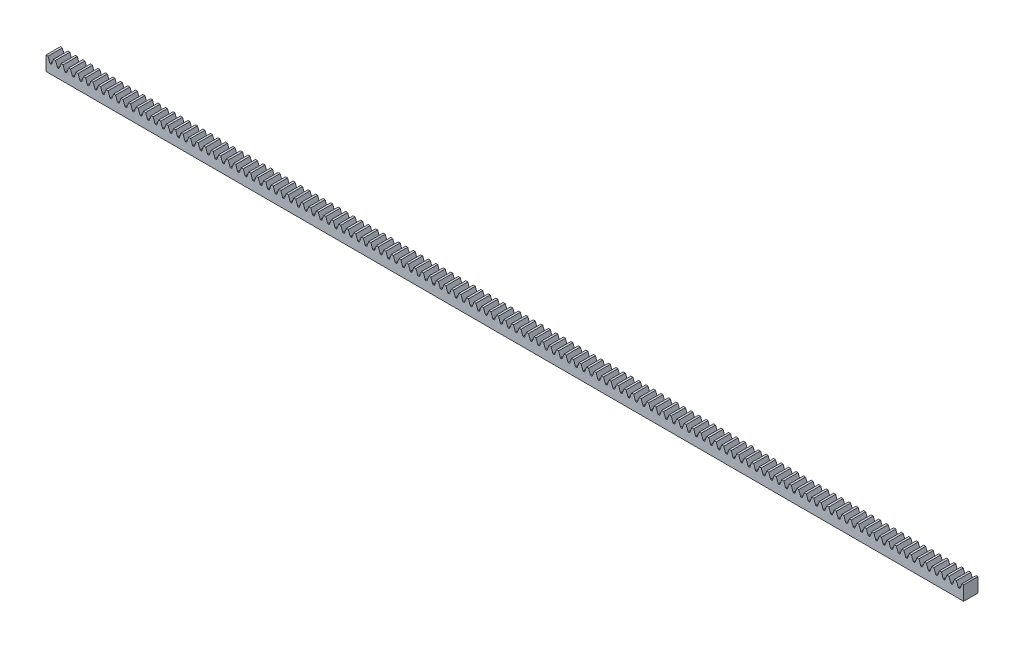
from build123d import *

# Parameters (mm, degrees)
BOSS_EXTRUDE1_DEPTH      = 152.4
BOSS_EXTRUDE1_DEPTH_BACK = 152.4
SKETCH2_W                = 4.7625
SKETCH2_H                = 4.7625
CUT_EXTRUDE1_DEPTH       = 153.492989209
FILLET1_R                = 0.154943948
LPATTERN1_START          = -2.38125
LPATTERN1_DEPTH          = 4.7625


# Read off the part's stored shape, not the designer's step: LPattern1
with BuildPart() as part:
    # Sketch2 → Boss-Extrude1 (new, two sides: drawn at the far end of the back side and taken through both)
    with BuildSketch(Plane(origin=(0, 0, 0), x_dir=(0, 0, -1), z_dir=(1, 0, 0)).offset(-BOSS_EXTRUDE1_DEPTH_BACK)):
        with Locations((0, 2.38125)):
            Rectangle(SKETCH2_W, SKETCH2_H)
    extrude(amount=BOSS_EXTRUDE1_DEPTH + BOSS_EXTRUDE1_DEPTH_BACK)

    # Sketch3 → Cut-Extrude1 (cut, symmetric)
    with BuildSketch(Plane.XY):
        Polygon((-151.730980247, 4.7625), (-151.076907537, 2.96545), (-150.560427709, 2.96545), (-149.906355, 4.7625), align=None)
    extrude(amount=CUT_EXTRUDE1_DEPTH, both=True, mode=Mode.SUBTRACT)

    # Fillet1
    fillet1_edges = [part.edges().sort_by_distance(p)[0] for p in [
        (-150.560427709, 2.96545, 0),
        (-151.076907537, 2.96545, 0),
    ]]
    fillet(fillet1_edges, radius=FILLET1_R)

    # LPattern1 outline → LPattern1 (cut)
    with BuildSketch(Plane.XY.offset(LPATTERN1_START)):
        with BuildLine():
            ThreePointArc((-148.620369302, 3.067399997), (-148.563641815, 2.993471296), (-148.474769617, 2.96545))
            Line((-148.474769617, 2.96545), (-148.17527563, 2.96545))
            ThreePointArc((-148.17527563, 2.96545), (-148.086403432, 2.993471296), (-148.029675945, 3.067399997))
            Line((-148.029675945, 3.067399997), (-147.41271, 4.7625))
            Line((-147.41271, 4.7625), (-149.237335247, 4.7625))
            Line((-149.237335247, 4.7625), (-148.620369302, 3.067399997))
        make_face()
        with BuildLine():
            Line((151.82469, 4.7625), (150.000064753, 4.7625))
            Line((150.000064753, 4.7625), (150.617030698, 3.067399997))
            ThreePointArc((150.617030698, 3.067399997), (150.673758185, 2.993471296), (150.762630383, 2.96545))
            Line((150.762630383, 2.96545), (151.06212437, 2.96545))
            ThreePointArc((151.06212437, 2.96545), (151.150996568, 2.993471296), (151.207724055, 3.067399997))
            Line((151.207724055, 3.067399997), (151.82469, 4.7625))
        make_face()
        with BuildLine():
            Line((149.331045, 4.7625), (147.506419753, 4.7625))
            Line((147.506419753, 4.7625), (148.123385698, 3.067399997))
            ThreePointArc((148.123385698, 3.067399997), (148.180113185, 2.993471296), (148.268985383, 2.96545))
            Line((148.268985383, 2.96545), (148.56847937, 2.96545))
            ThreePointArc((148.56847937, 2.96545), (148.657351568, 2.993471296), (148.714079055, 3.067399997))
            Line((148.714079055, 3.067399997), (149.331045, 4.7625))
        make_face()
        with BuildLine():
            Line((146.8374, 4.7625), (145.012774753, 4.7625))
            Line((145.012774753, 4.7625), (145.629740698, 3.067399997))
            ThreePointArc((145.629740698, 3.067399997), (145.686468185, 2.993471296), (145.775340383, 2.96545))
            Line((145.775340383, 2.96545), (146.07483437, 2.96545))
            ThreePointArc((146.07483437, 2.96545), (146.163706568, 2.993471296), (146.220434055, 3.067399997))
            Line((146.220434055, 3.067399997), (146.8374, 4.7625))
        make_face()
        with BuildLine():
            Line((144.343755, 4.7625), (142.519129753, 4.7625))
            Line((142.519129753, 4.7625), (143.136095698, 3.067399997))
            ThreePointArc((143.136095698, 3.067399997), (143.192823185, 2.993471296), (143.281695383, 2.96545))
            Line((143.281695383, 2.96545), (143.58118937, 2.96545))
            ThreePointArc((143.58118937, 2.96545), (143.670061568, 2.993471296), (143.726789055, 3.067399997))
            Line((143.726789055, 3.067399997), (144.343755, 4.7625))
        make_face()
        with BuildLine():
            Line((141.85011, 4.7625), (140.025484753, 4.7625))
            Line((140.025484753, 4.7625), (140.642450698, 3.067399997))
            ThreePointArc((140.642450698, 3.067399997), (140.699178185, 2.993471296), (140.788050383, 2.96545))
            Line((140.788050383, 2.96545), (141.08754437, 2.96545))
            ThreePointArc((141.08754437, 2.96545), (141.176416568, 2.993471296), (141.233144055, 3.067399997))
            Line((141.233144055, 3.067399997), (141.85011, 4.7625))
        make_face()
        with BuildLine():
            Line((139.356465, 4.7625), (137.531839753, 4.7625))
            Line((137.531839753, 4.7625), (138.148805698, 3.067399997))
            ThreePointArc((138.148805698, 3.067399997), (138.205533185, 2.993471296), (138.294405383, 2.96545))
            Line((138.294405383, 2.96545), (138.59389937, 2.96545))
            ThreePointArc((138.59389937, 2.96545), (138.682771568, 2.993471296), (138.739499055, 3.067399997))
            Line((138.739499055, 3.067399997), (139.356465, 4.7625))
        make_face()
        with BuildLine():
            Line((136.86282, 4.7625), (135.038194753, 4.7625))
            Line((135.038194753, 4.7625), (135.655160698, 3.067399997))
            ThreePointArc((135.655160698, 3.067399997), (135.711888185, 2.993471296), (135.800760383, 2.96545))
            Line((135.800760383, 2.96545), (136.10025437, 2.96545))
            ThreePointArc((136.10025437, 2.96545), (136.189126568, 2.993471296), (136.245854055, 3.067399997))
            Line((136.245854055, 3.067399997), (136.86282, 4.7625))
        make_face()
        with BuildLine():
            Line((134.369175, 4.7625), (132.544549753, 4.7625))
            Line((132.544549753, 4.7625), (133.161515698, 3.067399997))
            ThreePointArc((133.161515698, 3.067399997), (133.218243185, 2.993471296), (133.307115383, 2.96545))
            Line((133.307115383, 2.96545), (133.60660937, 2.96545))
            ThreePointArc((133.60660937, 2.96545), (133.695481568, 2.993471296), (133.752209055, 3.067399997))
            Line((133.752209055, 3.067399997), (134.369175, 4.7625))
        make_face()
        with BuildLine():
            Line((131.87553, 4.7625), (130.050904753, 4.7625))
            Line((130.050904753, 4.7625), (130.667870698, 3.067399997))
            ThreePointArc((130.667870698, 3.067399997), (130.724598185, 2.993471296), (130.813470383, 2.96545))
            Line((130.813470383, 2.96545), (131.11296437, 2.96545))
            ThreePointArc((131.11296437, 2.96545), (131.201836568, 2.993471296), (131.258564055, 3.067399997))
            Line((131.258564055, 3.067399997), (131.87553, 4.7625))
        make_face()
        with BuildLine():
            Line((129.381885, 4.7625), (127.557259753, 4.7625))
            Line((127.557259753, 4.7625), (128.174225698, 3.067399997))
            ThreePointArc((128.174225698, 3.067399997), (128.230953185, 2.993471296), (128.319825383, 2.96545))
            Line((128.319825383, 2.96545), (128.61931937, 2.96545))
            ThreePointArc((128.61931937, 2.96545), (128.708191568, 2.993471296), (128.764919055, 3.067399997))
            Line((128.764919055, 3.067399997), (129.381885, 4.7625))
        make_face()
        with BuildLine():
            Line((126.88824, 4.7625), (125.063614753, 4.7625))
            Line((125.063614753, 4.7625), (125.680580698, 3.067399997))
            ThreePointArc((125.680580698, 3.067399997), (125.737308185, 2.993471296), (125.826180383, 2.96545))
            Line((125.826180383, 2.96545), (126.12567437, 2.96545))
            ThreePointArc((126.12567437, 2.96545), (126.214546568, 2.993471296), (126.271274055, 3.067399997))
            Line((126.271274055, 3.067399997), (126.88824, 4.7625))
        make_face()
        with BuildLine():
            Line((124.394595, 4.7625), (122.569969753, 4.7625))
            Line((122.569969753, 4.7625), (123.186935698, 3.067399997))
            ThreePointArc((123.186935698, 3.067399997), (123.243663185, 2.993471296), (123.332535383, 2.96545))
            Line((123.332535383, 2.96545), (123.63202937, 2.96545))
            ThreePointArc((123.63202937, 2.96545), (123.720901568, 2.993471296), (123.777629055, 3.067399997))
            Line((123.777629055, 3.067399997), (124.394595, 4.7625))
        make_face()
        with BuildLine():
            Line((121.90095, 4.7625), (120.076324753, 4.7625))
            Line((120.076324753, 4.7625), (120.693290698, 3.067399997))
            ThreePointArc((120.693290698, 3.067399997), (120.750018185, 2.993471296), (120.838890383, 2.96545))
            Line((120.838890383, 2.96545), (121.13838437, 2.96545))
            ThreePointArc((121.13838437, 2.96545), (121.227256568, 2.993471296), (121.283984055, 3.067399997))
            Line((121.283984055, 3.067399997), (121.90095, 4.7625))
        make_face()
        with BuildLine():
            Line((119.407305, 4.7625), (117.582679753, 4.7625))
            Line((117.582679753, 4.7625), (118.199645698, 3.067399997))
            ThreePointArc((118.199645698, 3.067399997), (118.256373185, 2.993471296), (118.345245383, 2.96545))
            Line((118.345245383, 2.96545), (118.64473937, 2.96545))
            ThreePointArc((118.64473937, 2.96545), (118.733611568, 2.993471296), (118.790339055, 3.067399997))
            Line((118.790339055, 3.067399997), (119.407305, 4.7625))
        make_face()
        with BuildLine():
            Line((116.91366, 4.7625), (115.089034753, 4.7625))
            Line((115.089034753, 4.7625), (115.706000698, 3.067399997))
            ThreePointArc((115.706000698, 3.067399997), (115.762728185, 2.993471296), (115.851600383, 2.96545))
            Line((115.851600383, 2.96545), (116.15109437, 2.96545))
            ThreePointArc((116.15109437, 2.96545), (116.239966568, 2.993471296), (116.296694055, 3.067399997))
            Line((116.296694055, 3.067399997), (116.91366, 4.7625))
        make_face()
        with BuildLine():
            Line((114.420015, 4.7625), (112.595389753, 4.7625))
            Line((112.595389753, 4.7625), (113.212355698, 3.067399997))
            ThreePointArc((113.212355698, 3.067399997), (113.269083185, 2.993471296), (113.357955383, 2.96545))
            Line((113.357955383, 2.96545), (113.65744937, 2.96545))
            ThreePointArc((113.65744937, 2.96545), (113.746321568, 2.993471296), (113.803049055, 3.067399997))
            Line((113.803049055, 3.067399997), (114.420015, 4.7625))
        make_face()
        with BuildLine():
            Line((111.92637, 4.7625), (110.101744753, 4.7625))
            Line((110.101744753, 4.7625), (110.718710698, 3.067399997))
            ThreePointArc((110.718710698, 3.067399997), (110.775438185, 2.993471296), (110.864310383, 2.96545))
            Line((110.864310383, 2.96545), (111.16380437, 2.96545))
            ThreePointArc((111.16380437, 2.96545), (111.252676568, 2.993471296), (111.309404055, 3.067399997))
            Line((111.309404055, 3.067399997), (111.92637, 4.7625))
        make_face()
        with BuildLine():
            Line((109.432725, 4.7625), (107.608099753, 4.7625))
            Line((107.608099753, 4.7625), (108.225065698, 3.067399997))
            ThreePointArc((108.225065698, 3.067399997), (108.281793185, 2.993471296), (108.370665383, 2.96545))
            Line((108.370665383, 2.96545), (108.67015937, 2.96545))
            ThreePointArc((108.67015937, 2.96545), (108.759031568, 2.993471296), (108.815759055, 3.067399997))
            Line((108.815759055, 3.067399997), (109.432725, 4.7625))
        make_face()
        with BuildLine():
            Line((106.93908, 4.7625), (105.114454753, 4.7625))
            Line((105.114454753, 4.7625), (105.731420698, 3.067399997))
            ThreePointArc((105.731420698, 3.067399997), (105.788148185, 2.993471296), (105.877020383, 2.96545))
            Line((105.877020383, 2.96545), (106.17651437, 2.96545))
            ThreePointArc((106.17651437, 2.96545), (106.265386568, 2.993471296), (106.322114055, 3.067399997))
            Line((106.322114055, 3.067399997), (106.93908, 4.7625))
        make_face()
        with BuildLine():
            Line((104.445435, 4.7625), (102.620809753, 4.7625))
            Line((102.620809753, 4.7625), (103.237775698, 3.067399997))
            ThreePointArc((103.237775698, 3.067399997), (103.294503185, 2.993471296), (103.383375383, 2.96545))
            Line((103.383375383, 2.96545), (103.68286937, 2.96545))
            ThreePointArc((103.68286937, 2.96545), (103.771741568, 2.993471296), (103.828469055, 3.067399997))
            Line((103.828469055, 3.067399997), (104.445435, 4.7625))
        make_face()
        with BuildLine():
            Line((101.95179, 4.7625), (100.127164753, 4.7625))
            Line((100.127164753, 4.7625), (100.744130698, 3.067399997))
            ThreePointArc((100.744130698, 3.067399997), (100.800858185, 2.993471296), (100.889730383, 2.96545))
            Line((100.889730383, 2.96545), (101.18922437, 2.96545))
            ThreePointArc((101.18922437, 2.96545), (101.278096568, 2.993471296), (101.334824055, 3.067399997))
            Line((101.334824055, 3.067399997), (101.95179, 4.7625))
        make_face()
        with BuildLine():
            Line((99.458145, 4.7625), (97.633519753, 4.7625))
            Line((97.633519753, 4.7625), (98.250485698, 3.067399997))
            ThreePointArc((98.250485698, 3.067399997), (98.307213185, 2.993471296), (98.396085383, 2.96545))
            Line((98.396085383, 2.96545), (98.69557937, 2.96545))
            ThreePointArc((98.69557937, 2.96545), (98.784451568, 2.993471296), (98.841179055, 3.067399997))
            Line((98.841179055, 3.067399997), (99.458145, 4.7625))
        make_face()
        with BuildLine():
            Line((96.9645, 4.7625), (95.139874753, 4.7625))
            Line((95.139874753, 4.7625), (95.756840698, 3.067399997))
            ThreePointArc((95.756840698, 3.067399997), (95.813568185, 2.993471296), (95.902440383, 2.96545))
            Line((95.902440383, 2.96545), (96.20193437, 2.96545))
            ThreePointArc((96.20193437, 2.96545), (96.290806568, 2.993471296), (96.347534055, 3.067399997))
            Line((96.347534055, 3.067399997), (96.9645, 4.7625))
        make_face()
        with BuildLine():
            Line((94.470855, 4.7625), (92.646229753, 4.7625))
            Line((92.646229753, 4.7625), (93.263195698, 3.067399997))
            ThreePointArc((93.263195698, 3.067399997), (93.319923185, 2.993471296), (93.408795383, 2.96545))
            Line((93.408795383, 2.96545), (93.70828937, 2.96545))
            ThreePointArc((93.70828937, 2.96545), (93.797161568, 2.993471296), (93.853889055, 3.067399997))
            Line((93.853889055, 3.067399997), (94.470855, 4.7625))
        make_face()
        with BuildLine():
            Line((91.97721, 4.7625), (90.152584753, 4.7625))
            Line((90.152584753, 4.7625), (90.769550698, 3.067399997))
            ThreePointArc((90.769550698, 3.067399997), (90.826278185, 2.993471296), (90.915150383, 2.96545))
            Line((90.915150383, 2.96545), (91.21464437, 2.96545))
            ThreePointArc((91.21464437, 2.96545), (91.303516568, 2.993471296), (91.360244055, 3.067399997))
            Line((91.360244055, 3.067399997), (91.97721, 4.7625))
        make_face()
        with BuildLine():
            Line((89.483565, 4.7625), (87.658939753, 4.7625))
            Line((87.658939753, 4.7625), (88.275905698, 3.067399997))
            ThreePointArc((88.275905698, 3.067399997), (88.332633185, 2.993471296), (88.421505383, 2.96545))
            Line((88.421505383, 2.96545), (88.72099937, 2.96545))
            ThreePointArc((88.72099937, 2.96545), (88.809871568, 2.993471296), (88.866599055, 3.067399997))
            Line((88.866599055, 3.067399997), (89.483565, 4.7625))
        make_face()
        with BuildLine():
            Line((86.98992, 4.7625), (85.165294753, 4.7625))
            Line((85.165294753, 4.7625), (85.782260698, 3.067399997))
            ThreePointArc((85.782260698, 3.067399997), (85.838988185, 2.993471296), (85.927860383, 2.96545))
            Line((85.927860383, 2.96545), (86.22735437, 2.96545))
            ThreePointArc((86.22735437, 2.96545), (86.316226568, 2.993471296), (86.372954055, 3.067399997))
            Line((86.372954055, 3.067399997), (86.98992, 4.7625))
        make_face()
        with BuildLine():
            Line((84.496275, 4.7625), (82.671649753, 4.7625))
            Line((82.671649753, 4.7625), (83.288615698, 3.067399997))
            ThreePointArc((83.288615698, 3.067399997), (83.345343185, 2.993471296), (83.434215383, 2.96545))
            Line((83.434215383, 2.96545), (83.73370937, 2.96545))
            ThreePointArc((83.73370937, 2.96545), (83.822581568, 2.993471296), (83.879309055, 3.067399997))
            Line((83.879309055, 3.067399997), (84.496275, 4.7625))
        make_face()
        with BuildLine():
            Line((82.00263, 4.7625), (80.178004753, 4.7625))
            Line((80.178004753, 4.7625), (80.794970698, 3.067399997))
            ThreePointArc((80.794970698, 3.067399997), (80.851698185, 2.993471296), (80.940570383, 2.96545))
            Line((80.940570383, 2.96545), (81.24006437, 2.96545))
            ThreePointArc((81.24006437, 2.96545), (81.328936568, 2.993471296), (81.385664055, 3.067399997))
            Line((81.385664055, 3.067399997), (82.00263, 4.7625))
        make_face()
        with BuildLine():
            Line((79.508985, 4.7625), (77.684359753, 4.7625))
            Line((77.684359753, 4.7625), (78.301325698, 3.067399997))
            ThreePointArc((78.301325698, 3.067399997), (78.358053185, 2.993471296), (78.446925383, 2.96545))
            Line((78.446925383, 2.96545), (78.74641937, 2.96545))
            ThreePointArc((78.74641937, 2.96545), (78.835291568, 2.993471296), (78.892019055, 3.067399997))
            Line((78.892019055, 3.067399997), (79.508985, 4.7625))
        make_face()
        with BuildLine():
            Line((77.01534, 4.7625), (75.190714753, 4.7625))
            Line((75.190714753, 4.7625), (75.807680698, 3.067399997))
            ThreePointArc((75.807680698, 3.067399997), (75.864408185, 2.993471296), (75.953280383, 2.96545))
            Line((75.953280383, 2.96545), (76.25277437, 2.96545))
            ThreePointArc((76.25277437, 2.96545), (76.341646568, 2.993471296), (76.398374055, 3.067399997))
            Line((76.398374055, 3.067399997), (77.01534, 4.7625))
        make_face()
        with BuildLine():
            Line((74.521695, 4.7625), (72.697069753, 4.7625))
            Line((72.697069753, 4.7625), (73.314035698, 3.067399997))
            ThreePointArc((73.314035698, 3.067399997), (73.370763185, 2.993471296), (73.459635383, 2.96545))
            Line((73.459635383, 2.96545), (73.75912937, 2.96545))
            ThreePointArc((73.75912937, 2.96545), (73.848001568, 2.993471296), (73.904729055, 3.067399997))
            Line((73.904729055, 3.067399997), (74.521695, 4.7625))
        make_face()
        with BuildLine():
            Line((72.02805, 4.7625), (70.203424753, 4.7625))
            Line((70.203424753, 4.7625), (70.820390698, 3.067399997))
            ThreePointArc((70.820390698, 3.067399997), (70.877118185, 2.993471296), (70.965990383, 2.96545))
            Line((70.965990383, 2.96545), (71.26548437, 2.96545))
            ThreePointArc((71.26548437, 2.96545), (71.354356568, 2.993471296), (71.411084055, 3.067399997))
            Line((71.411084055, 3.067399997), (72.02805, 4.7625))
        make_face()
        with BuildLine():
            Line((69.534405, 4.7625), (67.709779753, 4.7625))
            Line((67.709779753, 4.7625), (68.326745698, 3.067399997))
            ThreePointArc((68.326745698, 3.067399997), (68.383473185, 2.993471296), (68.472345383, 2.96545))
            Line((68.472345383, 2.96545), (68.77183937, 2.96545))
            ThreePointArc((68.77183937, 2.96545), (68.860711568, 2.993471296), (68.917439055, 3.067399997))
            Line((68.917439055, 3.067399997), (69.534405, 4.7625))
        make_face()
        with BuildLine():
            Line((67.04076, 4.7625), (65.216134753, 4.7625))
            Line((65.216134753, 4.7625), (65.833100698, 3.067399997))
            ThreePointArc((65.833100698, 3.067399997), (65.889828185, 2.993471296), (65.978700383, 2.96545))
            Line((65.978700383, 2.96545), (66.27819437, 2.96545))
            ThreePointArc((66.27819437, 2.96545), (66.367066568, 2.993471296), (66.423794055, 3.067399997))
            Line((66.423794055, 3.067399997), (67.04076, 4.7625))
        make_face()
        with BuildLine():
            Line((64.547115, 4.7625), (62.722489753, 4.7625))
            Line((62.722489753, 4.7625), (63.339455698, 3.067399997))
            ThreePointArc((63.339455698, 3.067399997), (63.396183185, 2.993471296), (63.485055383, 2.96545))
            Line((63.485055383, 2.96545), (63.78454937, 2.96545))
            ThreePointArc((63.78454937, 2.96545), (63.873421568, 2.993471296), (63.930149055, 3.067399997))
            Line((63.930149055, 3.067399997), (64.547115, 4.7625))
        make_face()
        with BuildLine():
            Line((62.05347, 4.7625), (60.228844753, 4.7625))
            Line((60.228844753, 4.7625), (60.845810698, 3.067399997))
            ThreePointArc((60.845810698, 3.067399997), (60.902538185, 2.993471296), (60.991410383, 2.96545))
            Line((60.991410383, 2.96545), (61.29090437, 2.96545))
            ThreePointArc((61.29090437, 2.96545), (61.379776568, 2.993471296), (61.436504055, 3.067399997))
            Line((61.436504055, 3.067399997), (62.05347, 4.7625))
        make_face()
        with BuildLine():
            Line((59.559825, 4.7625), (57.735199753, 4.7625))
            Line((57.735199753, 4.7625), (58.352165698, 3.067399997))
            ThreePointArc((58.352165698, 3.067399997), (58.408893185, 2.993471296), (58.497765383, 2.96545))
            Line((58.497765383, 2.96545), (58.79725937, 2.96545))
            ThreePointArc((58.79725937, 2.96545), (58.886131568, 2.993471296), (58.942859055, 3.067399997))
            Line((58.942859055, 3.067399997), (59.559825, 4.7625))
        make_face()
        with BuildLine():
            Line((57.06618, 4.7625), (55.241554753, 4.7625))
            Line((55.241554753, 4.7625), (55.858520698, 3.067399997))
            ThreePointArc((55.858520698, 3.067399997), (55.915248185, 2.993471296), (56.004120383, 2.96545))
            Line((56.004120383, 2.96545), (56.30361437, 2.96545))
            ThreePointArc((56.30361437, 2.96545), (56.392486568, 2.993471296), (56.449214055, 3.067399997))
            Line((56.449214055, 3.067399997), (57.06618, 4.7625))
        make_face()
        with BuildLine():
            Line((54.572535, 4.7625), (52.747909753, 4.7625))
            Line((52.747909753, 4.7625), (53.364875698, 3.067399997))
            ThreePointArc((53.364875698, 3.067399997), (53.421603185, 2.993471296), (53.510475383, 2.96545))
            Line((53.510475383, 2.96545), (53.80996937, 2.96545))
            ThreePointArc((53.80996937, 2.96545), (53.898841568, 2.993471296), (53.955569055, 3.067399997))
            Line((53.955569055, 3.067399997), (54.572535, 4.7625))
        make_face()
        with BuildLine():
            Line((52.07889, 4.7625), (50.254264753, 4.7625))
            Line((50.254264753, 4.7625), (50.871230698, 3.067399997))
            ThreePointArc((50.871230698, 3.067399997), (50.927958185, 2.993471296), (51.016830383, 2.96545))
            Line((51.016830383, 2.96545), (51.31632437, 2.96545))
            ThreePointArc((51.31632437, 2.96545), (51.405196568, 2.993471296), (51.461924055, 3.067399997))
            Line((51.461924055, 3.067399997), (52.07889, 4.7625))
        make_face()
        with BuildLine():
            Line((49.585245, 4.7625), (47.760619753, 4.7625))
            Line((47.760619753, 4.7625), (48.377585698, 3.067399997))
            ThreePointArc((48.377585698, 3.067399997), (48.434313185, 2.993471296), (48.523185383, 2.96545))
            Line((48.523185383, 2.96545), (48.82267937, 2.96545))
            ThreePointArc((48.82267937, 2.96545), (48.911551568, 2.993471296), (48.968279055, 3.067399997))
            Line((48.968279055, 3.067399997), (49.585245, 4.7625))
        make_face()
        with BuildLine():
            Line((47.0916, 4.7625), (45.266974753, 4.7625))
            Line((45.266974753, 4.7625), (45.883940698, 3.067399997))
            ThreePointArc((45.883940698, 3.067399997), (45.940668185, 2.993471296), (46.029540383, 2.96545))
            Line((46.029540383, 2.96545), (46.32903437, 2.96545))
            ThreePointArc((46.32903437, 2.96545), (46.417906568, 2.993471296), (46.474634055, 3.067399997))
            Line((46.474634055, 3.067399997), (47.0916, 4.7625))
        make_face()
        with BuildLine():
            Line((44.597955, 4.7625), (42.773329753, 4.7625))
            Line((42.773329753, 4.7625), (43.390295698, 3.067399997))
            ThreePointArc((43.390295698, 3.067399997), (43.447023185, 2.993471296), (43.535895383, 2.96545))
            Line((43.535895383, 2.96545), (43.83538937, 2.96545))
            ThreePointArc((43.83538937, 2.96545), (43.924261568, 2.993471296), (43.980989055, 3.067399997))
            Line((43.980989055, 3.067399997), (44.597955, 4.7625))
        make_face()
        with BuildLine():
            Line((42.10431, 4.7625), (40.279684753, 4.7625))
            Line((40.279684753, 4.7625), (40.896650698, 3.067399997))
            ThreePointArc((40.896650698, 3.067399997), (40.953378185, 2.993471296), (41.042250383, 2.96545))
            Line((41.042250383, 2.96545), (41.34174437, 2.96545))
            ThreePointArc((41.34174437, 2.96545), (41.430616568, 2.993471296), (41.487344055, 3.067399997))
            Line((41.487344055, 3.067399997), (42.10431, 4.7625))
        make_face()
        with BuildLine():
            Line((39.610665, 4.7625), (37.786039753, 4.7625))
            Line((37.786039753, 4.7625), (38.403005698, 3.067399997))
            ThreePointArc((38.403005698, 3.067399997), (38.459733185, 2.993471296), (38.548605383, 2.96545))
            Line((38.548605383, 2.96545), (38.84809937, 2.96545))
            ThreePointArc((38.84809937, 2.96545), (38.936971568, 2.993471296), (38.993699055, 3.067399997))
            Line((38.993699055, 3.067399997), (39.610665, 4.7625))
        make_face()
        with BuildLine():
            Line((37.11702, 4.7625), (35.292394753, 4.7625))
            Line((35.292394753, 4.7625), (35.909360698, 3.067399997))
            ThreePointArc((35.909360698, 3.067399997), (35.966088185, 2.993471296), (36.054960383, 2.96545))
            Line((36.054960383, 2.96545), (36.35445437, 2.96545))
            ThreePointArc((36.35445437, 2.96545), (36.443326568, 2.993471296), (36.500054055, 3.067399997))
            Line((36.500054055, 3.067399997), (37.11702, 4.7625))
        make_face()
        with BuildLine():
            Line((34.623375, 4.7625), (32.798749753, 4.7625))
            Line((32.798749753, 4.7625), (33.415715698, 3.067399997))
            ThreePointArc((33.415715698, 3.067399997), (33.472443185, 2.993471296), (33.561315383, 2.96545))
            Line((33.561315383, 2.96545), (33.86080937, 2.96545))
            ThreePointArc((33.86080937, 2.96545), (33.949681568, 2.993471296), (34.006409055, 3.067399997))
            Line((34.006409055, 3.067399997), (34.623375, 4.7625))
        make_face()
        with BuildLine():
            Line((32.12973, 4.7625), (30.305104753, 4.7625))
            Line((30.305104753, 4.7625), (30.922070698, 3.067399997))
            ThreePointArc((30.922070698, 3.067399997), (30.978798185, 2.993471296), (31.067670383, 2.96545))
            Line((31.067670383, 2.96545), (31.36716437, 2.96545))
            ThreePointArc((31.36716437, 2.96545), (31.456036568, 2.993471296), (31.512764055, 3.067399997))
            Line((31.512764055, 3.067399997), (32.12973, 4.7625))
        make_face()
        with BuildLine():
            Line((29.636085, 4.7625), (27.811459753, 4.7625))
            Line((27.811459753, 4.7625), (28.428425698, 3.067399997))
            ThreePointArc((28.428425698, 3.067399997), (28.485153185, 2.993471296), (28.574025383, 2.96545))
            Line((28.574025383, 2.96545), (28.87351937, 2.96545))
            ThreePointArc((28.87351937, 2.96545), (28.962391568, 2.993471296), (29.019119055, 3.067399997))
            Line((29.019119055, 3.067399997), (29.636085, 4.7625))
        make_face()
        with BuildLine():
            Line((27.14244, 4.7625), (25.317814753, 4.7625))
            Line((25.317814753, 4.7625), (25.934780698, 3.067399997))
            ThreePointArc((25.934780698, 3.067399997), (25.991508185, 2.993471296), (26.080380383, 2.96545))
            Line((26.080380383, 2.96545), (26.37987437, 2.96545))
            ThreePointArc((26.37987437, 2.96545), (26.468746568, 2.993471296), (26.525474055, 3.067399997))
            Line((26.525474055, 3.067399997), (27.14244, 4.7625))
        make_face()
        with BuildLine():
            Line((24.648795, 4.7625), (22.824169753, 4.7625))
            Line((22.824169753, 4.7625), (23.441135698, 3.067399997))
            ThreePointArc((23.441135698, 3.067399997), (23.497863185, 2.993471296), (23.586735383, 2.96545))
            Line((23.586735383, 2.96545), (23.88622937, 2.96545))
            ThreePointArc((23.88622937, 2.96545), (23.975101568, 2.993471296), (24.031829055, 3.067399997))
            Line((24.031829055, 3.067399997), (24.648795, 4.7625))
        make_face()
        with BuildLine():
            Line((22.15515, 4.7625), (20.330524753, 4.7625))
            Line((20.330524753, 4.7625), (20.947490698, 3.067399997))
            ThreePointArc((20.947490698, 3.067399997), (21.004218185, 2.993471296), (21.093090383, 2.96545))
            Line((21.093090383, 2.96545), (21.39258437, 2.96545))
            ThreePointArc((21.39258437, 2.96545), (21.481456568, 2.993471296), (21.538184055, 3.067399997))
            Line((21.538184055, 3.067399997), (22.15515, 4.7625))
        make_face()
        with BuildLine():
            Line((19.661505, 4.7625), (17.836879753, 4.7625))
            Line((17.836879753, 4.7625), (18.453845698, 3.067399997))
            ThreePointArc((18.453845698, 3.067399997), (18.510573185, 2.993471296), (18.599445383, 2.96545))
            Line((18.599445383, 2.96545), (18.89893937, 2.96545))
            ThreePointArc((18.89893937, 2.96545), (18.987811568, 2.993471296), (19.044539055, 3.067399997))
            Line((19.044539055, 3.067399997), (19.661505, 4.7625))
        make_face()
        with BuildLine():
            Line((17.16786, 4.7625), (15.343234753, 4.7625))
            Line((15.343234753, 4.7625), (15.960200698, 3.067399997))
            ThreePointArc((15.960200698, 3.067399997), (16.016928185, 2.993471296), (16.105800383, 2.96545))
            Line((16.105800383, 2.96545), (16.40529437, 2.96545))
            ThreePointArc((16.40529437, 2.96545), (16.494166568, 2.993471296), (16.550894055, 3.067399997))
            Line((16.550894055, 3.067399997), (17.16786, 4.7625))
        make_face()
        with BuildLine():
            Line((14.674215, 4.7625), (12.849589753, 4.7625))
            Line((12.849589753, 4.7625), (13.466555698, 3.067399997))
            ThreePointArc((13.466555698, 3.067399997), (13.523283185, 2.993471296), (13.612155383, 2.96545))
            Line((13.612155383, 2.96545), (13.91164937, 2.96545))
            ThreePointArc((13.91164937, 2.96545), (14.000521568, 2.993471296), (14.057249055, 3.067399997))
            Line((14.057249055, 3.067399997), (14.674215, 4.7625))
        make_face()
        with BuildLine():
            Line((12.18057, 4.7625), (10.355944753, 4.7625))
            Line((10.355944753, 4.7625), (10.972910698, 3.067399997))
            ThreePointArc((10.972910698, 3.067399997), (11.029638185, 2.993471296), (11.118510383, 2.96545))
            Line((11.118510383, 2.96545), (11.41800437, 2.96545))
            ThreePointArc((11.41800437, 2.96545), (11.506876568, 2.993471296), (11.563604055, 3.067399997))
            Line((11.563604055, 3.067399997), (12.18057, 4.7625))
        make_face()
        with BuildLine():
            Line((9.686925, 4.7625), (7.862299753, 4.7625))
            Line((7.862299753, 4.7625), (8.479265698, 3.067399997))
            ThreePointArc((8.479265698, 3.067399997), (8.535993185, 2.993471296), (8.624865383, 2.96545))
            Line((8.624865383, 2.96545), (8.92435937, 2.96545))
            ThreePointArc((8.92435937, 2.96545), (9.013231568, 2.993471296), (9.069959055, 3.067399997))
            Line((9.069959055, 3.067399997), (9.686925, 4.7625))
        make_face()
        with BuildLine():
            Line((7.19328, 4.7625), (5.368654753, 4.7625))
            Line((5.368654753, 4.7625), (5.985620698, 3.067399997))
            ThreePointArc((5.985620698, 3.067399997), (6.042348185, 2.993471296), (6.131220383, 2.96545))
            Line((6.131220383, 2.96545), (6.43071437, 2.96545))
            ThreePointArc((6.43071437, 2.96545), (6.519586568, 2.993471296), (6.576314055, 3.067399997))
            Line((6.576314055, 3.067399997), (7.19328, 4.7625))
        make_face()
        with BuildLine():
            Line((4.699635, 4.7625), (2.875009753, 4.7625))
            Line((2.875009753, 4.7625), (3.491975698, 3.067399997))
            ThreePointArc((3.491975698, 3.067399997), (3.548703185, 2.993471296), (3.637575383, 2.96545))
            Line((3.637575383, 2.96545), (3.93706937, 2.96545))
            ThreePointArc((3.93706937, 2.96545), (4.025941568, 2.993471296), (4.082669055, 3.067399997))
            Line((4.082669055, 3.067399997), (4.699635, 4.7625))
        make_face()
        with BuildLine():
            Line((2.20599, 4.7625), (0.381364753, 4.7625))
            Line((0.381364753, 4.7625), (0.998330698, 3.067399997))
            ThreePointArc((0.998330698, 3.067399997), (1.055058185, 2.993471296), (1.143930383, 2.96545))
            Line((1.143930383, 2.96545), (1.44342437, 2.96545))
            ThreePointArc((1.44342437, 2.96545), (1.532296568, 2.993471296), (1.589024055, 3.067399997))
            Line((1.589024055, 3.067399997), (2.20599, 4.7625))
        make_face()
        with BuildLine():
            Line((-0.287655, 4.7625), (-2.112280247, 4.7625))
            Line((-2.112280247, 4.7625), (-1.495314302, 3.067399997))
            ThreePointArc((-1.495314302, 3.067399997), (-1.438586815, 2.993471296), (-1.349714617, 2.96545))
            Line((-1.349714617, 2.96545), (-1.05022063, 2.96545))
            ThreePointArc((-1.05022063, 2.96545), (-0.961348432, 2.993471296), (-0.904620945, 3.067399997))
            Line((-0.904620945, 3.067399997), (-0.287655, 4.7625))
        make_face()
        with BuildLine():
            Line((-2.7813, 4.7625), (-4.605925247, 4.7625))
            Line((-4.605925247, 4.7625), (-3.988959302, 3.067399997))
            ThreePointArc((-3.988959302, 3.067399997), (-3.932231815, 2.993471296), (-3.843359617, 2.96545))
            Line((-3.843359617, 2.96545), (-3.54386563, 2.96545))
            ThreePointArc((-3.54386563, 2.96545), (-3.454993432, 2.993471296), (-3.398265945, 3.067399997))
            Line((-3.398265945, 3.067399997), (-2.7813, 4.7625))
        make_face()
        with BuildLine():
            Line((-5.274945, 4.7625), (-7.099570247, 4.7625))
            Line((-7.099570247, 4.7625), (-6.482604302, 3.067399997))
            ThreePointArc((-6.482604302, 3.067399997), (-6.425876815, 2.993471296), (-6.337004617, 2.96545))
            Line((-6.337004617, 2.96545), (-6.03751063, 2.96545))
            ThreePointArc((-6.03751063, 2.96545), (-5.948638432, 2.993471296), (-5.891910945, 3.067399997))
            Line((-5.891910945, 3.067399997), (-5.274945, 4.7625))
        make_face()
        with BuildLine():
            Line((-7.76859, 4.7625), (-9.593215247, 4.7625))
            Line((-9.593215247, 4.7625), (-8.976249302, 3.067399997))
            ThreePointArc((-8.976249302, 3.067399997), (-8.919521815, 2.993471296), (-8.830649617, 2.96545))
            Line((-8.830649617, 2.96545), (-8.53115563, 2.96545))
            ThreePointArc((-8.53115563, 2.96545), (-8.442283432, 2.993471296), (-8.385555945, 3.067399997))
            Line((-8.385555945, 3.067399997), (-7.76859, 4.7625))
        make_face()
        with BuildLine():
            Line((-10.262235, 4.7625), (-12.086860247, 4.7625))
            Line((-12.086860247, 4.7625), (-11.469894302, 3.067399997))
            ThreePointArc((-11.469894302, 3.067399997), (-11.413166815, 2.993471296), (-11.324294617, 2.96545))
            Line((-11.324294617, 2.96545), (-11.02480063, 2.96545))
            ThreePointArc((-11.02480063, 2.96545), (-10.935928432, 2.993471296), (-10.879200945, 3.067399997))
            Line((-10.879200945, 3.067399997), (-10.262235, 4.7625))
        make_face()
        with BuildLine():
            Line((-12.75588, 4.7625), (-14.580505247, 4.7625))
            Line((-14.580505247, 4.7625), (-13.963539302, 3.067399997))
            ThreePointArc((-13.963539302, 3.067399997), (-13.906811815, 2.993471296), (-13.817939617, 2.96545))
            Line((-13.817939617, 2.96545), (-13.51844563, 2.96545))
            ThreePointArc((-13.51844563, 2.96545), (-13.429573432, 2.993471296), (-13.372845945, 3.067399997))
            Line((-13.372845945, 3.067399997), (-12.75588, 4.7625))
        make_face()
        with BuildLine():
            Line((-15.249525, 4.7625), (-17.074150247, 4.7625))
            Line((-17.074150247, 4.7625), (-16.457184302, 3.067399997))
            ThreePointArc((-16.457184302, 3.067399997), (-16.400456815, 2.993471296), (-16.311584617, 2.96545))
            Line((-16.311584617, 2.96545), (-16.01209063, 2.96545))
            ThreePointArc((-16.01209063, 2.96545), (-15.923218432, 2.993471296), (-15.866490945, 3.067399997))
            Line((-15.866490945, 3.067399997), (-15.249525, 4.7625))
        make_face()
        with BuildLine():
            Line((-17.74317, 4.7625), (-19.567795247, 4.7625))
            Line((-19.567795247, 4.7625), (-18.950829302, 3.067399997))
            ThreePointArc((-18.950829302, 3.067399997), (-18.894101815, 2.993471296), (-18.805229617, 2.96545))
            Line((-18.805229617, 2.96545), (-18.50573563, 2.96545))
            ThreePointArc((-18.50573563, 2.96545), (-18.416863432, 2.993471296), (-18.360135945, 3.067399997))
            Line((-18.360135945, 3.067399997), (-17.74317, 4.7625))
        make_face()
        with BuildLine():
            Line((-20.236815, 4.7625), (-22.061440247, 4.7625))
            Line((-22.061440247, 4.7625), (-21.444474302, 3.067399997))
            ThreePointArc((-21.444474302, 3.067399997), (-21.387746815, 2.993471296), (-21.298874617, 2.96545))
            Line((-21.298874617, 2.96545), (-20.99938063, 2.96545))
            ThreePointArc((-20.99938063, 2.96545), (-20.910508432, 2.993471296), (-20.853780945, 3.067399997))
            Line((-20.853780945, 3.067399997), (-20.236815, 4.7625))
        make_face()
        with BuildLine():
            Line((-22.73046, 4.7625), (-24.555085247, 4.7625))
            Line((-24.555085247, 4.7625), (-23.938119302, 3.067399997))
            ThreePointArc((-23.938119302, 3.067399997), (-23.881391815, 2.993471296), (-23.792519617, 2.96545))
            Line((-23.792519617, 2.96545), (-23.49302563, 2.96545))
            ThreePointArc((-23.49302563, 2.96545), (-23.404153432, 2.993471296), (-23.347425945, 3.067399997))
            Line((-23.347425945, 3.067399997), (-22.73046, 4.7625))
        make_face()
        with BuildLine():
            Line((-25.224105, 4.7625), (-27.048730247, 4.7625))
            Line((-27.048730247, 4.7625), (-26.431764302, 3.067399997))
            ThreePointArc((-26.431764302, 3.067399997), (-26.375036815, 2.993471296), (-26.286164617, 2.96545))
            Line((-26.286164617, 2.96545), (-25.98667063, 2.96545))
            ThreePointArc((-25.98667063, 2.96545), (-25.897798432, 2.993471296), (-25.841070945, 3.067399997))
            Line((-25.841070945, 3.067399997), (-25.224105, 4.7625))
        make_face()
        with BuildLine():
            Line((-27.71775, 4.7625), (-29.542375247, 4.7625))
            Line((-29.542375247, 4.7625), (-28.925409302, 3.067399997))
            ThreePointArc((-28.925409302, 3.067399997), (-28.868681815, 2.993471296), (-28.779809617, 2.96545))
            Line((-28.779809617, 2.96545), (-28.48031563, 2.96545))
            ThreePointArc((-28.48031563, 2.96545), (-28.391443432, 2.993471296), (-28.334715945, 3.067399997))
            Line((-28.334715945, 3.067399997), (-27.71775, 4.7625))
        make_face()
        with BuildLine():
            Line((-30.211395, 4.7625), (-32.036020247, 4.7625))
            Line((-32.036020247, 4.7625), (-31.419054302, 3.067399997))
            ThreePointArc((-31.419054302, 3.067399997), (-31.362326815, 2.993471296), (-31.273454617, 2.96545))
            Line((-31.273454617, 2.96545), (-30.97396063, 2.96545))
            ThreePointArc((-30.97396063, 2.96545), (-30.885088432, 2.993471296), (-30.828360945, 3.067399997))
            Line((-30.828360945, 3.067399997), (-30.211395, 4.7625))
        make_face()
        with BuildLine():
            Line((-32.70504, 4.7625), (-34.529665247, 4.7625))
            Line((-34.529665247, 4.7625), (-33.912699302, 3.067399997))
            ThreePointArc((-33.912699302, 3.067399997), (-33.855971815, 2.993471296), (-33.767099617, 2.96545))
            Line((-33.767099617, 2.96545), (-33.46760563, 2.96545))
            ThreePointArc((-33.46760563, 2.96545), (-33.378733432, 2.993471296), (-33.322005945, 3.067399997))
            Line((-33.322005945, 3.067399997), (-32.70504, 4.7625))
        make_face()
        with BuildLine():
            Line((-35.198685, 4.7625), (-37.023310247, 4.7625))
            Line((-37.023310247, 4.7625), (-36.406344302, 3.067399997))
            ThreePointArc((-36.406344302, 3.067399997), (-36.349616815, 2.993471296), (-36.260744617, 2.96545))
            Line((-36.260744617, 2.96545), (-35.96125063, 2.96545))
            ThreePointArc((-35.96125063, 2.96545), (-35.872378432, 2.993471296), (-35.815650945, 3.067399997))
            Line((-35.815650945, 3.067399997), (-35.198685, 4.7625))
        make_face()
        with BuildLine():
            Line((-37.69233, 4.7625), (-39.516955247, 4.7625))
            Line((-39.516955247, 4.7625), (-38.899989302, 3.067399997))
            ThreePointArc((-38.899989302, 3.067399997), (-38.843261815, 2.993471296), (-38.754389617, 2.96545))
            Line((-38.754389617, 2.96545), (-38.45489563, 2.96545))
            ThreePointArc((-38.45489563, 2.96545), (-38.366023432, 2.993471296), (-38.309295945, 3.067399997))
            Line((-38.309295945, 3.067399997), (-37.69233, 4.7625))
        make_face()
        with BuildLine():
            Line((-40.185975, 4.7625), (-42.010600247, 4.7625))
            Line((-42.010600247, 4.7625), (-41.393634302, 3.067399997))
            ThreePointArc((-41.393634302, 3.067399997), (-41.336906815, 2.993471296), (-41.248034617, 2.96545))
            Line((-41.248034617, 2.96545), (-40.94854063, 2.96545))
            ThreePointArc((-40.94854063, 2.96545), (-40.859668432, 2.993471296), (-40.802940945, 3.067399997))
            Line((-40.802940945, 3.067399997), (-40.185975, 4.7625))
        make_face()
        with BuildLine():
            Line((-42.67962, 4.7625), (-44.504245247, 4.7625))
            Line((-44.504245247, 4.7625), (-43.887279302, 3.067399997))
            ThreePointArc((-43.887279302, 3.067399997), (-43.830551815, 2.993471296), (-43.741679617, 2.96545))
            Line((-43.741679617, 2.96545), (-43.44218563, 2.96545))
            ThreePointArc((-43.44218563, 2.96545), (-43.353313432, 2.993471296), (-43.296585945, 3.067399997))
            Line((-43.296585945, 3.067399997), (-42.67962, 4.7625))
        make_face()
        with BuildLine():
            Line((-45.173265, 4.7625), (-46.997890247, 4.7625))
            Line((-46.997890247, 4.7625), (-46.380924302, 3.067399997))
            ThreePointArc((-46.380924302, 3.067399997), (-46.324196815, 2.993471296), (-46.235324617, 2.96545))
            Line((-46.235324617, 2.96545), (-45.93583063, 2.96545))
            ThreePointArc((-45.93583063, 2.96545), (-45.846958432, 2.993471296), (-45.790230945, 3.067399997))
            Line((-45.790230945, 3.067399997), (-45.173265, 4.7625))
        make_face()
        with BuildLine():
            Line((-47.66691, 4.7625), (-49.491535247, 4.7625))
            Line((-49.491535247, 4.7625), (-48.874569302, 3.067399997))
            ThreePointArc((-48.874569302, 3.067399997), (-48.817841815, 2.993471296), (-48.728969617, 2.96545))
            Line((-48.728969617, 2.96545), (-48.42947563, 2.96545))
            ThreePointArc((-48.42947563, 2.96545), (-48.340603432, 2.993471296), (-48.283875945, 3.067399997))
            Line((-48.283875945, 3.067399997), (-47.66691, 4.7625))
        make_face()
        with BuildLine():
            Line((-50.160555, 4.7625), (-51.985180247, 4.7625))
            Line((-51.985180247, 4.7625), (-51.368214302, 3.067399997))
            ThreePointArc((-51.368214302, 3.067399997), (-51.311486815, 2.993471296), (-51.222614617, 2.96545))
            Line((-51.222614617, 2.96545), (-50.92312063, 2.96545))
            ThreePointArc((-50.92312063, 2.96545), (-50.834248432, 2.993471296), (-50.777520945, 3.067399997))
            Line((-50.777520945, 3.067399997), (-50.160555, 4.7625))
        make_face()
        with BuildLine():
            Line((-52.6542, 4.7625), (-54.478825247, 4.7625))
            Line((-54.478825247, 4.7625), (-53.861859302, 3.067399997))
            ThreePointArc((-53.861859302, 3.067399997), (-53.805131815, 2.993471296), (-53.716259617, 2.96545))
            Line((-53.716259617, 2.96545), (-53.41676563, 2.96545))
            ThreePointArc((-53.41676563, 2.96545), (-53.327893432, 2.993471296), (-53.271165945, 3.067399997))
            Line((-53.271165945, 3.067399997), (-52.6542, 4.7625))
        make_face()
        with BuildLine():
            Line((-55.147845, 4.7625), (-56.972470247, 4.7625))
            Line((-56.972470247, 4.7625), (-56.355504302, 3.067399997))
            ThreePointArc((-56.355504302, 3.067399997), (-56.298776815, 2.993471296), (-56.209904617, 2.96545))
            Line((-56.209904617, 2.96545), (-55.91041063, 2.96545))
            ThreePointArc((-55.91041063, 2.96545), (-55.821538432, 2.993471296), (-55.764810945, 3.067399997))
            Line((-55.764810945, 3.067399997), (-55.147845, 4.7625))
        make_face()
        with BuildLine():
            Line((-57.64149, 4.7625), (-59.466115247, 4.7625))
            Line((-59.466115247, 4.7625), (-58.849149302, 3.067399997))
            ThreePointArc((-58.849149302, 3.067399997), (-58.792421815, 2.993471296), (-58.703549617, 2.96545))
            Line((-58.703549617, 2.96545), (-58.40405563, 2.96545))
            ThreePointArc((-58.40405563, 2.96545), (-58.315183432, 2.993471296), (-58.258455945, 3.067399997))
            Line((-58.258455945, 3.067399997), (-57.64149, 4.7625))
        make_face()
        with BuildLine():
            Line((-60.135135, 4.7625), (-61.959760247, 4.7625))
            Line((-61.959760247, 4.7625), (-61.342794302, 3.067399997))
            ThreePointArc((-61.342794302, 3.067399997), (-61.286066815, 2.993471296), (-61.197194617, 2.96545))
            Line((-61.197194617, 2.96545), (-60.89770063, 2.96545))
            ThreePointArc((-60.89770063, 2.96545), (-60.808828432, 2.993471296), (-60.752100945, 3.067399997))
            Line((-60.752100945, 3.067399997), (-60.135135, 4.7625))
        make_face()
        with BuildLine():
            Line((-62.62878, 4.7625), (-64.453405247, 4.7625))
            Line((-64.453405247, 4.7625), (-63.836439302, 3.067399997))
            ThreePointArc((-63.836439302, 3.067399997), (-63.779711815, 2.993471296), (-63.690839617, 2.96545))
            Line((-63.690839617, 2.96545), (-63.39134563, 2.96545))
            ThreePointArc((-63.39134563, 2.96545), (-63.302473432, 2.993471296), (-63.245745945, 3.067399997))
            Line((-63.245745945, 3.067399997), (-62.62878, 4.7625))
        make_face()
        with BuildLine():
            Line((-65.122425, 4.7625), (-66.947050247, 4.7625))
            Line((-66.947050247, 4.7625), (-66.330084302, 3.067399997))
            ThreePointArc((-66.330084302, 3.067399997), (-66.273356815, 2.993471296), (-66.184484617, 2.96545))
            Line((-66.184484617, 2.96545), (-65.88499063, 2.96545))
            ThreePointArc((-65.88499063, 2.96545), (-65.796118432, 2.993471296), (-65.739390945, 3.067399997))
            Line((-65.739390945, 3.067399997), (-65.122425, 4.7625))
        make_face()
        with BuildLine():
            Line((-67.61607, 4.7625), (-69.440695247, 4.7625))
            Line((-69.440695247, 4.7625), (-68.823729302, 3.067399997))
            ThreePointArc((-68.823729302, 3.067399997), (-68.767001815, 2.993471296), (-68.678129617, 2.96545))
            Line((-68.678129617, 2.96545), (-68.37863563, 2.96545))
            ThreePointArc((-68.37863563, 2.96545), (-68.289763432, 2.993471296), (-68.233035945, 3.067399997))
            Line((-68.233035945, 3.067399997), (-67.61607, 4.7625))
        make_face()
        with BuildLine():
            Line((-70.109715, 4.7625), (-71.934340247, 4.7625))
            Line((-71.934340247, 4.7625), (-71.317374302, 3.067399997))
            ThreePointArc((-71.317374302, 3.067399997), (-71.260646815, 2.993471296), (-71.171774617, 2.96545))
            Line((-71.171774617, 2.96545), (-70.87228063, 2.96545))
            ThreePointArc((-70.87228063, 2.96545), (-70.783408432, 2.993471296), (-70.726680945, 3.067399997))
            Line((-70.726680945, 3.067399997), (-70.109715, 4.7625))
        make_face()
        with BuildLine():
            Line((-72.60336, 4.7625), (-74.427985247, 4.7625))
            Line((-74.427985247, 4.7625), (-73.811019302, 3.067399997))
            ThreePointArc((-73.811019302, 3.067399997), (-73.754291815, 2.993471296), (-73.665419617, 2.96545))
            Line((-73.665419617, 2.96545), (-73.36592563, 2.96545))
            ThreePointArc((-73.36592563, 2.96545), (-73.277053432, 2.993471296), (-73.220325945, 3.067399997))
            Line((-73.220325945, 3.067399997), (-72.60336, 4.7625))
        make_face()
        with BuildLine():
            Line((-75.097005, 4.7625), (-76.921630247, 4.7625))
            Line((-76.921630247, 4.7625), (-76.304664302, 3.067399997))
            ThreePointArc((-76.304664302, 3.067399997), (-76.247936815, 2.993471296), (-76.159064617, 2.96545))
            Line((-76.159064617, 2.96545), (-75.85957063, 2.96545))
            ThreePointArc((-75.85957063, 2.96545), (-75.770698432, 2.993471296), (-75.713970945, 3.067399997))
            Line((-75.713970945, 3.067399997), (-75.097005, 4.7625))
        make_face()
        with BuildLine():
            Line((-77.59065, 4.7625), (-79.415275247, 4.7625))
            Line((-79.415275247, 4.7625), (-78.798309302, 3.067399997))
            ThreePointArc((-78.798309302, 3.067399997), (-78.741581815, 2.993471296), (-78.652709617, 2.96545))
            Line((-78.652709617, 2.96545), (-78.35321563, 2.96545))
            ThreePointArc((-78.35321563, 2.96545), (-78.264343432, 2.993471296), (-78.207615945, 3.067399997))
            Line((-78.207615945, 3.067399997), (-77.59065, 4.7625))
        make_face()
        with BuildLine():
            Line((-80.084295, 4.7625), (-81.908920247, 4.7625))
            Line((-81.908920247, 4.7625), (-81.291954302, 3.067399997))
            ThreePointArc((-81.291954302, 3.067399997), (-81.235226815, 2.993471296), (-81.146354617, 2.96545))
            Line((-81.146354617, 2.96545), (-80.84686063, 2.96545))
            ThreePointArc((-80.84686063, 2.96545), (-80.757988432, 2.993471296), (-80.701260945, 3.067399997))
            Line((-80.701260945, 3.067399997), (-80.084295, 4.7625))
        make_face()
        with BuildLine():
            Line((-82.57794, 4.7625), (-84.402565247, 4.7625))
            Line((-84.402565247, 4.7625), (-83.785599302, 3.067399997))
            ThreePointArc((-83.785599302, 3.067399997), (-83.728871815, 2.993471296), (-83.639999617, 2.96545))
            Line((-83.639999617, 2.96545), (-83.34050563, 2.96545))
            ThreePointArc((-83.34050563, 2.96545), (-83.251633432, 2.993471296), (-83.194905945, 3.067399997))
            Line((-83.194905945, 3.067399997), (-82.57794, 4.7625))
        make_face()
        with BuildLine():
            Line((-85.071585, 4.7625), (-86.896210247, 4.7625))
            Line((-86.896210247, 4.7625), (-86.279244302, 3.067399997))
            ThreePointArc((-86.279244302, 3.067399997), (-86.222516815, 2.993471296), (-86.133644617, 2.96545))
            Line((-86.133644617, 2.96545), (-85.83415063, 2.96545))
            ThreePointArc((-85.83415063, 2.96545), (-85.745278432, 2.993471296), (-85.688550945, 3.067399997))
            Line((-85.688550945, 3.067399997), (-85.071585, 4.7625))
        make_face()
        with BuildLine():
            Line((-87.56523, 4.7625), (-89.389855247, 4.7625))
            Line((-89.389855247, 4.7625), (-88.772889302, 3.067399997))
            ThreePointArc((-88.772889302, 3.067399997), (-88.716161815, 2.993471296), (-88.627289617, 2.96545))
            Line((-88.627289617, 2.96545), (-88.32779563, 2.96545))
            ThreePointArc((-88.32779563, 2.96545), (-88.238923432, 2.993471296), (-88.182195945, 3.067399997))
            Line((-88.182195945, 3.067399997), (-87.56523, 4.7625))
        make_face()
        with BuildLine():
            Line((-90.058875, 4.7625), (-91.883500247, 4.7625))
            Line((-91.883500247, 4.7625), (-91.266534302, 3.067399997))
            ThreePointArc((-91.266534302, 3.067399997), (-91.209806815, 2.993471296), (-91.120934617, 2.96545))
            Line((-91.120934617, 2.96545), (-90.82144063, 2.96545))
            ThreePointArc((-90.82144063, 2.96545), (-90.732568432, 2.993471296), (-90.675840945, 3.067399997))
            Line((-90.675840945, 3.067399997), (-90.058875, 4.7625))
        make_face()
        with BuildLine():
            Line((-92.55252, 4.7625), (-94.377145247, 4.7625))
            Line((-94.377145247, 4.7625), (-93.760179302, 3.067399997))
            ThreePointArc((-93.760179302, 3.067399997), (-93.703451815, 2.993471296), (-93.614579617, 2.96545))
            Line((-93.614579617, 2.96545), (-93.31508563, 2.96545))
            ThreePointArc((-93.31508563, 2.96545), (-93.226213432, 2.993471296), (-93.169485945, 3.067399997))
            Line((-93.169485945, 3.067399997), (-92.55252, 4.7625))
        make_face()
        with BuildLine():
            Line((-95.046165, 4.7625), (-96.870790247, 4.7625))
            Line((-96.870790247, 4.7625), (-96.253824302, 3.067399997))
            ThreePointArc((-96.253824302, 3.067399997), (-96.197096815, 2.993471296), (-96.108224617, 2.96545))
            Line((-96.108224617, 2.96545), (-95.80873063, 2.96545))
            ThreePointArc((-95.80873063, 2.96545), (-95.719858432, 2.993471296), (-95.663130945, 3.067399997))
            Line((-95.663130945, 3.067399997), (-95.046165, 4.7625))
        make_face()
        with BuildLine():
            Line((-97.53981, 4.7625), (-99.364435247, 4.7625))
            Line((-99.364435247, 4.7625), (-98.747469302, 3.067399997))
            ThreePointArc((-98.747469302, 3.067399997), (-98.690741815, 2.993471296), (-98.601869617, 2.96545))
            Line((-98.601869617, 2.96545), (-98.30237563, 2.96545))
            ThreePointArc((-98.30237563, 2.96545), (-98.213503432, 2.993471296), (-98.156775945, 3.067399997))
            Line((-98.156775945, 3.067399997), (-97.53981, 4.7625))
        make_face()
        with BuildLine():
            Line((-100.033455, 4.7625), (-101.858080247, 4.7625))
            Line((-101.858080247, 4.7625), (-101.241114302, 3.067399997))
            ThreePointArc((-101.241114302, 3.067399997), (-101.184386815, 2.993471296), (-101.095514617, 2.96545))
            Line((-101.095514617, 2.96545), (-100.79602063, 2.96545))
            ThreePointArc((-100.79602063, 2.96545), (-100.707148432, 2.993471296), (-100.650420945, 3.067399997))
            Line((-100.650420945, 3.067399997), (-100.033455, 4.7625))
        make_face()
        with BuildLine():
            Line((-102.5271, 4.7625), (-104.351725247, 4.7625))
            Line((-104.351725247, 4.7625), (-103.734759302, 3.067399997))
            ThreePointArc((-103.734759302, 3.067399997), (-103.678031815, 2.993471296), (-103.589159617, 2.96545))
            Line((-103.589159617, 2.96545), (-103.28966563, 2.96545))
            ThreePointArc((-103.28966563, 2.96545), (-103.200793432, 2.993471296), (-103.144065945, 3.067399997))
            Line((-103.144065945, 3.067399997), (-102.5271, 4.7625))
        make_face()
        with BuildLine():
            Line((-105.020745, 4.7625), (-106.845370247, 4.7625))
            Line((-106.845370247, 4.7625), (-106.228404302, 3.067399997))
            ThreePointArc((-106.228404302, 3.067399997), (-106.171676815, 2.993471296), (-106.082804617, 2.96545))
            Line((-106.082804617, 2.96545), (-105.78331063, 2.96545))
            ThreePointArc((-105.78331063, 2.96545), (-105.694438432, 2.993471296), (-105.637710945, 3.067399997))
            Line((-105.637710945, 3.067399997), (-105.020745, 4.7625))
        make_face()
        with BuildLine():
            Line((-107.51439, 4.7625), (-109.339015247, 4.7625))
            Line((-109.339015247, 4.7625), (-108.722049302, 3.067399997))
            ThreePointArc((-108.722049302, 3.067399997), (-108.665321815, 2.993471296), (-108.576449617, 2.96545))
            Line((-108.576449617, 2.96545), (-108.27695563, 2.96545))
            ThreePointArc((-108.27695563, 2.96545), (-108.188083432, 2.993471296), (-108.131355945, 3.067399997))
            Line((-108.131355945, 3.067399997), (-107.51439, 4.7625))
        make_face()
        with BuildLine():
            Line((-110.008035, 4.7625), (-111.832660247, 4.7625))
            Line((-111.832660247, 4.7625), (-111.215694302, 3.067399997))
            ThreePointArc((-111.215694302, 3.067399997), (-111.158966815, 2.993471296), (-111.070094617, 2.96545))
            Line((-111.070094617, 2.96545), (-110.77060063, 2.96545))
            ThreePointArc((-110.77060063, 2.96545), (-110.681728432, 2.993471296), (-110.625000945, 3.067399997))
            Line((-110.625000945, 3.067399997), (-110.008035, 4.7625))
        make_face()
        with BuildLine():
            Line((-112.50168, 4.7625), (-114.326305247, 4.7625))
            Line((-114.326305247, 4.7625), (-113.709339302, 3.067399997))
            ThreePointArc((-113.709339302, 3.067399997), (-113.652611815, 2.993471296), (-113.563739617, 2.96545))
            Line((-113.563739617, 2.96545), (-113.26424563, 2.96545))
            ThreePointArc((-113.26424563, 2.96545), (-113.175373432, 2.993471296), (-113.118645945, 3.067399997))
            Line((-113.118645945, 3.067399997), (-112.50168, 4.7625))
        make_face()
        with BuildLine():
            Line((-114.995325, 4.7625), (-116.819950247, 4.7625))
            Line((-116.819950247, 4.7625), (-116.202984302, 3.067399997))
            ThreePointArc((-116.202984302, 3.067399997), (-116.146256815, 2.993471296), (-116.057384617, 2.96545))
            Line((-116.057384617, 2.96545), (-115.75789063, 2.96545))
            ThreePointArc((-115.75789063, 2.96545), (-115.669018432, 2.993471296), (-115.612290945, 3.067399997))
            Line((-115.612290945, 3.067399997), (-114.995325, 4.7625))
        make_face()
        with BuildLine():
            Line((-117.48897, 4.7625), (-119.313595247, 4.7625))
            Line((-119.313595247, 4.7625), (-118.696629302, 3.067399997))
            ThreePointArc((-118.696629302, 3.067399997), (-118.639901815, 2.993471296), (-118.551029617, 2.96545))
            Line((-118.551029617, 2.96545), (-118.25153563, 2.96545))
            ThreePointArc((-118.25153563, 2.96545), (-118.162663432, 2.993471296), (-118.105935945, 3.067399997))
            Line((-118.105935945, 3.067399997), (-117.48897, 4.7625))
        make_face()
        with BuildLine():
            Line((-119.982615, 4.7625), (-121.807240247, 4.7625))
            Line((-121.807240247, 4.7625), (-121.190274302, 3.067399997))
            ThreePointArc((-121.190274302, 3.067399997), (-121.133546815, 2.993471296), (-121.044674617, 2.96545))
            Line((-121.044674617, 2.96545), (-120.74518063, 2.96545))
            ThreePointArc((-120.74518063, 2.96545), (-120.656308432, 2.993471296), (-120.599580945, 3.067399997))
            Line((-120.599580945, 3.067399997), (-119.982615, 4.7625))
        make_face()
        with BuildLine():
            Line((-122.47626, 4.7625), (-124.300885247, 4.7625))
            Line((-124.300885247, 4.7625), (-123.683919302, 3.067399997))
            ThreePointArc((-123.683919302, 3.067399997), (-123.627191815, 2.993471296), (-123.538319617, 2.96545))
            Line((-123.538319617, 2.96545), (-123.23882563, 2.96545))
            ThreePointArc((-123.23882563, 2.96545), (-123.149953432, 2.993471296), (-123.093225945, 3.067399997))
            Line((-123.093225945, 3.067399997), (-122.47626, 4.7625))
        make_face()
        with BuildLine():
            Line((-124.969905, 4.7625), (-126.794530247, 4.7625))
            Line((-126.794530247, 4.7625), (-126.177564302, 3.067399997))
            ThreePointArc((-126.177564302, 3.067399997), (-126.120836815, 2.993471296), (-126.031964617, 2.96545))
            Line((-126.031964617, 2.96545), (-125.73247063, 2.96545))
            ThreePointArc((-125.73247063, 2.96545), (-125.643598432, 2.993471296), (-125.586870945, 3.067399997))
            Line((-125.586870945, 3.067399997), (-124.969905, 4.7625))
        make_face()
        with BuildLine():
            Line((-127.46355, 4.7625), (-129.288175247, 4.7625))
            Line((-129.288175247, 4.7625), (-128.671209302, 3.067399997))
            ThreePointArc((-128.671209302, 3.067399997), (-128.614481815, 2.993471296), (-128.525609617, 2.96545))
            Line((-128.525609617, 2.96545), (-128.22611563, 2.96545))
            ThreePointArc((-128.22611563, 2.96545), (-128.137243432, 2.993471296), (-128.080515945, 3.067399997))
            Line((-128.080515945, 3.067399997), (-127.46355, 4.7625))
        make_face()
        with BuildLine():
            Line((-129.957195, 4.7625), (-131.781820247, 4.7625))
            Line((-131.781820247, 4.7625), (-131.164854302, 3.067399997))
            ThreePointArc((-131.164854302, 3.067399997), (-131.108126815, 2.993471296), (-131.019254617, 2.96545))
            Line((-131.019254617, 2.96545), (-130.71976063, 2.96545))
            ThreePointArc((-130.71976063, 2.96545), (-130.630888432, 2.993471296), (-130.574160945, 3.067399997))
            Line((-130.574160945, 3.067399997), (-129.957195, 4.7625))
        make_face()
        with BuildLine():
            Line((-132.45084, 4.7625), (-134.275465247, 4.7625))
            Line((-134.275465247, 4.7625), (-133.658499302, 3.067399997))
            ThreePointArc((-133.658499302, 3.067399997), (-133.601771815, 2.993471296), (-133.512899617, 2.96545))
            Line((-133.512899617, 2.96545), (-133.21340563, 2.96545))
            ThreePointArc((-133.21340563, 2.96545), (-133.124533432, 2.993471296), (-133.067805945, 3.067399997))
            Line((-133.067805945, 3.067399997), (-132.45084, 4.7625))
        make_face()
        with BuildLine():
            Line((-134.944485, 4.7625), (-136.769110247, 4.7625))
            Line((-136.769110247, 4.7625), (-136.152144302, 3.067399997))
            ThreePointArc((-136.152144302, 3.067399997), (-136.095416815, 2.993471296), (-136.006544617, 2.96545))
            Line((-136.006544617, 2.96545), (-135.70705063, 2.96545))
            ThreePointArc((-135.70705063, 2.96545), (-135.618178432, 2.993471296), (-135.561450945, 3.067399997))
            Line((-135.561450945, 3.067399997), (-134.944485, 4.7625))
        make_face()
        with BuildLine():
            Line((-137.43813, 4.7625), (-139.262755247, 4.7625))
            Line((-139.262755247, 4.7625), (-138.645789302, 3.067399997))
            ThreePointArc((-138.645789302, 3.067399997), (-138.589061815, 2.993471296), (-138.500189617, 2.96545))
            Line((-138.500189617, 2.96545), (-138.20069563, 2.96545))
            ThreePointArc((-138.20069563, 2.96545), (-138.111823432, 2.993471296), (-138.055095945, 3.067399997))
            Line((-138.055095945, 3.067399997), (-137.43813, 4.7625))
        make_face()
        with BuildLine():
            Line((-139.931775, 4.7625), (-141.756400247, 4.7625))
            Line((-141.756400247, 4.7625), (-141.139434302, 3.067399997))
            ThreePointArc((-141.139434302, 3.067399997), (-141.082706815, 2.993471296), (-140.993834617, 2.96545))
            Line((-140.993834617, 2.96545), (-140.69434063, 2.96545))
            ThreePointArc((-140.69434063, 2.96545), (-140.605468432, 2.993471296), (-140.548740945, 3.067399997))
            Line((-140.548740945, 3.067399997), (-139.931775, 4.7625))
        make_face()
        with BuildLine():
            Line((-142.42542, 4.7625), (-144.250045247, 4.7625))
            Line((-144.250045247, 4.7625), (-143.633079302, 3.067399997))
            ThreePointArc((-143.633079302, 3.067399997), (-143.576351815, 2.993471296), (-143.487479617, 2.96545))
            Line((-143.487479617, 2.96545), (-143.18798563, 2.96545))
            ThreePointArc((-143.18798563, 2.96545), (-143.099113432, 2.993471296), (-143.042385945, 3.067399997))
            Line((-143.042385945, 3.067399997), (-142.42542, 4.7625))
        make_face()
        with BuildLine():
            Line((-144.919065, 4.7625), (-146.743690247, 4.7625))
            Line((-146.743690247, 4.7625), (-146.126724302, 3.067399997))
            ThreePointArc((-146.126724302, 3.067399997), (-146.069996815, 2.993471296), (-145.981124617, 2.96545))
            Line((-145.981124617, 2.96545), (-145.68163063, 2.96545))
            ThreePointArc((-145.68163063, 2.96545), (-145.592758432, 2.993471296), (-145.536030945, 3.067399997))
            Line((-145.536030945, 3.067399997), (-144.919065, 4.7625))
        make_face()
    extrude(amount=LPATTERN1_DEPTH, mode=Mode.SUBTRACT)


solid = part.part
